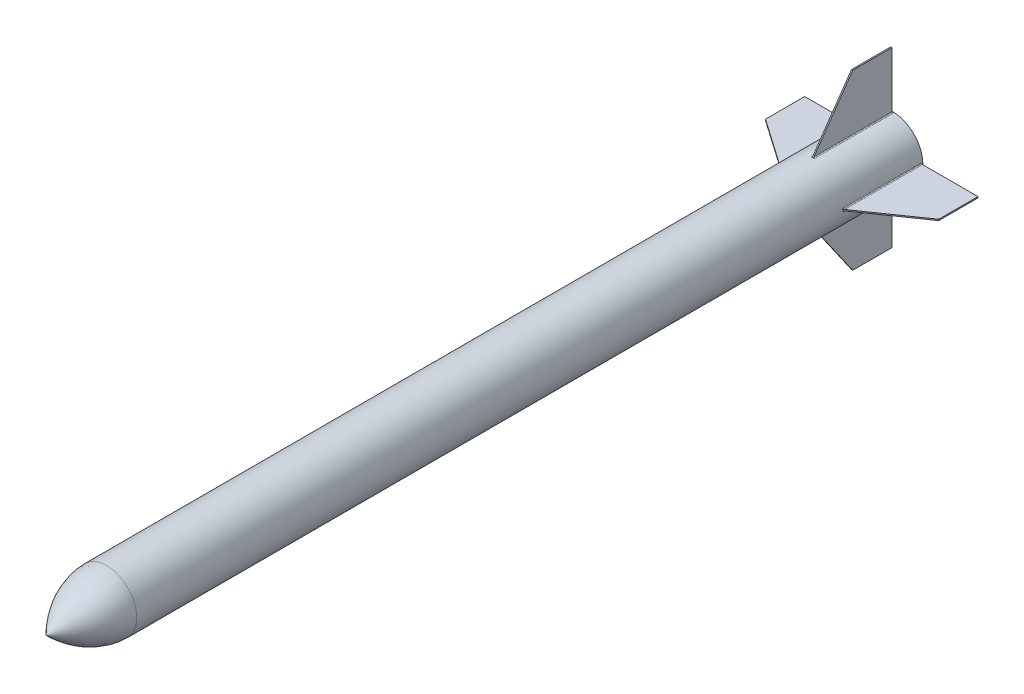
from build123d import *

# Parameters (mm, degrees)
SKETCH3_R                = 43.942
BOSS_EXTRUDE1_DEPTH      = 15.24
BOSS_EXTRUDE2_REACH      = 2240.211
BOSS_EXTRUDE2_END_RADIUS = 78.322932
SKETCH4_W                = 3.175
SKETCH4_H                = 203.2
CUT_EXTRUDE1_REACH       = 2229.902
FILLET1_R                = 2.54
CIRPATTERN1_COUNT        = 4
FILLET1_OF_CIRPATTERN1_R = 2.54


with BuildPart() as part:
    # Sketch2 → Revolve1 (revolve)
    with BuildSketch(Plane(origin=(0, 0, 0), x_dir=(0, 0, -1), z_dir=(1, 0, 0))):
        with BuildLine():
            Line((161.200401562, 77.77155292), (2196.692901562, 77.77155292))
            Line((2196.692901562, 77.77155292), (2196.692901562, -0.55137908))
            Line((2196.692901562, -0.55137908), (4.482401562, -0.55137908))
            add(Edge.make_bspline(
                [(4.482401562, -0.55137908), (82.841401562, 77.77155292), (161.200401562, 77.77155292)],
                knots=[0.067653722, 0.067653722, 0.067653722, 0.915241247, 0.915241247, 0.915241247], degree=2))
        make_face()
    revolve(axis=Axis((0, -0.55137908, -2196.692901562), (0, 0, 1)))

    # Sketch3 → Boss-Extrude1 (add)
    with BuildSketch(Plane(origin=(0, 0, -2196.692901562), x_dir=(-1, 0, 0), z_dir=(0, 0, -1))):
        with Locations(Location((0, 0, 0), (0, 0, 270))):
            Circle(SKETCH3_R)
    extrude(amount=BOSS_EXTRUDE1_DEPTH)

    # Boss-Extrude2: up to this cylinder (the profile starts outside it)
    boss_extrude2_end = Plane(origin=(0, -0.55137908, -2091.917902), z_dir=(0, 0, -1)) * Cylinder(BOSS_EXTRUDE2_END_RADIUS, 4638.067864, mode=Mode.PRIVATE)
    # Sketch4 → Boss-Extrude2 (add, up to the surface)
    with BuildSketch(Plane(origin=(0, 254, 0), x_dir=(1, 0, 0), z_dir=(0, 1, 0)), mode=Mode.PRIVATE) as boss_extrude2_sk1:
        with Locations((0, 2091.917901562)):
            Rectangle(SKETCH4_W, SKETCH4_H)
    boss_extrude2_tool1 = extrude(boss_extrude2_sk1.sketch, amount=-BOSS_EXTRUDE2_REACH, mode=Mode.PRIVATE) - boss_extrude2_end
    boss_extrude2 = boss_extrude2_tool1.solids().sort_by_distance((0, 254, -2091.917902))[0]
    add(boss_extrude2)

    # Sketch5 → Cut-Extrude1 (cut, up to next)
    with BuildSketch(Plane.ZY.offset(1.5875), mode=Mode.PRIVATE) as cut_extrude1_sk1:
        Polygon((-2193.517901562, 223.805463028), (-2091.917901562, 223.805463028), (-1990.317901562, 77.755463028), (-1990.317901562, 254), (-2193.517901562, 254), align=None)
    cut_extrude1_tool1 = extrude(cut_extrude1_sk1.sketch, amount=-CUT_EXTRUDE1_REACH, mode=Mode.PRIVATE) & part.part
    cut_extrude1 = cut_extrude1_tool1.solids().sort_by_distance((-1.5875, 203.992033, -2054.843652))[0]
    add(cut_extrude1, mode=Mode.SUBTRACT)

    # Fillet1
    # the kernel refuses this fillet: 2.54 mm, written as the material it adds along each edge
    with BuildSketch(Plane(origin=(-1.5875, 77.755463028, -1984.191199419), x_dir=(-0.9993639751499004, -0.035660134220012574, 0), z_dir=(0, 0, -1))) as fillet1_piece_1_section:
        with BuildLine():
            CenterArc((2.450992889, 2.539698904), FILLET1_R, 182.043608468, 87.074170625)
            Line((-0.087391608, 2.449122163), (0, 0))
            ThreePointArc((0, 0), (1.205942189, 0.009284527), (2.411884379, 0))
        make_face()
    fillet1_piece_1 = extrude(amount=209.326702143, mode=Mode.PRIVATE)
    fillet1_piece_1 = split(fillet1_piece_1, bisect_by=Plane(origin=(-3.095055571, 77.697259455, -1990.27741212), z_dir=(0, -0.5710644881986003, -0.820905201785487)), keep=Keep.TOP, mode=Mode.PRIVATE)
    add(fillet1_piece_1)
    with BuildSketch(Plane(origin=(1.5875, 77.755463028, -1984.191199419), x_dir=(0.9993639751499004, -0.03566013422001344, 0), z_dir=(0, 0, -1))) as fillet1_piece_2_section:
        with BuildLine():
            CenterArc((2.450992889, -2.539698904), FILLET1_R, 90.882220907, 87.074170625)
            Line((-0.087391608, -2.449122163), (0, 0))
            ThreePointArc((0, 0), (1.205942189, -0.009284527), (2.411884379, 0))
        make_face()
    fillet1_piece_2 = extrude(amount=209.326702143, mode=Mode.PRIVATE)
    fillet1_piece_2 = split(fillet1_piece_2, bisect_by=Plane(origin=(3.095055571, 77.697259455, -1990.27741212), z_dir=(0, -0.5710644881986003, -0.820905201785487)), keep=Keep.TOP, mode=Mode.PRIVATE)
    add(fillet1_piece_2)

    # CirPattern1: Boss-Extrude2, Cut-Extrude1 ×4 about axis
    cirpattern1_axis = Axis((0, -0.55137908, 0), (0, 0, 1))
    add([boss_extrude2.rotate(cirpattern1_axis, i * 360 / CIRPATTERN1_COUNT) for i in range(1, CIRPATTERN1_COUNT)])
    add([cut_extrude1.rotate(cirpattern1_axis, i * 360 / CIRPATTERN1_COUNT) for i in range(1, CIRPATTERN1_COUNT)], mode=Mode.SUBTRACT)

    # Fillet1 of CirPattern1
    # the kernel refuses this fillet: 2.54 mm, written as the material it adds along each edge
    with BuildSketch(Plane(origin=(-78.306842107, -2.13887908, -1984.191199419), x_dir=(0.035660134220018555, -0.9993639751499002, 0), z_dir=(0, 0, -1))) as fillet1_of_cirpattern1_piece_1_section:
        with BuildLine():
            CenterArc((2.450992889, 2.539698904), FILLET1_OF_CIRPATTERN1_R, 182.043608468, 87.074170625)
            Line((-0.087391608, 2.449122163), (0, 0))
            ThreePointArc((0, 0), (1.205942189, 0.009284527), (2.411884379, 0))
        make_face()
    fillet1_of_cirpattern1_piece_1 = extrude(amount=209.326702143, mode=Mode.PRIVATE)
    fillet1_of_cirpattern1_piece_1 = split(fillet1_of_cirpattern1_piece_1, bisect_by=Plane(origin=(-78.248638535, -3.646434651, -1990.27741212), z_dir=(0.5710644881986003, 0, -0.820905201785487)), keep=Keep.TOP, mode=Mode.PRIVATE)
    add(fillet1_of_cirpattern1_piece_1)
    with BuildSketch(Plane(origin=(-78.306842107, 1.03612092, -1984.191199419), x_dir=(0.03566013422001241, 0.9993639751499004, 0), z_dir=(0, 0, -1))) as fillet1_of_cirpattern1_piece_2_section:
        with BuildLine():
            CenterArc((2.450992889, -2.539698904), FILLET1_OF_CIRPATTERN1_R, 90.882220907, 87.074170625)
            Line((-0.087391608, -2.449122163), (0, 0))
            ThreePointArc((0, 0), (1.205942189, -0.009284527), (2.411884379, 0))
        make_face()
    fillet1_of_cirpattern1_piece_2 = extrude(amount=209.326702143, mode=Mode.PRIVATE)
    fillet1_of_cirpattern1_piece_2 = split(fillet1_of_cirpattern1_piece_2, bisect_by=Plane(origin=(-78.248638535, 2.543676491, -1990.27741212), z_dir=(0.5710644881986003, 0, -0.820905201785487)), keep=Keep.TOP, mode=Mode.PRIVATE)
    add(fillet1_of_cirpattern1_piece_2)
    with BuildSketch(Plane(origin=(1.5875, -78.858221187, -1984.191199419), x_dir=(0.9993639751499, 0.035660134220024196, 0), z_dir=(0, 0, -1))) as fillet1_of_cirpattern1_piece_3_section:
        with BuildLine():
            CenterArc((2.450992889, 2.539698904), FILLET1_OF_CIRPATTERN1_R, 182.043608468, 87.074170625)
            Line((-0.087391608, 2.449122163), (0, 0))
            ThreePointArc((0, 0), (1.205942189, 0.009284527), (2.411884379, 0))
        make_face()
    fillet1_of_cirpattern1_piece_3 = extrude(amount=209.326702143, mode=Mode.PRIVATE)
    fillet1_of_cirpattern1_piece_3 = split(fillet1_of_cirpattern1_piece_3, bisect_by=Plane(origin=(3.095055571, -78.800017614, -1990.27741212), z_dir=(0, 0.5710644881986003, -0.820905201785487)), keep=Keep.TOP, mode=Mode.PRIVATE)
    add(fillet1_of_cirpattern1_piece_3)
    with BuildSketch(Plane(origin=(-1.5875, -78.858221187, -1984.191199419), x_dir=(-0.9993639751499004, 0.03566013422001241, 0), z_dir=(0, 0, -1))) as fillet1_of_cirpattern1_piece_4_section:
        with BuildLine():
            CenterArc((2.450992889, -2.539698904), FILLET1_OF_CIRPATTERN1_R, 90.882220907, 87.074170625)
            Line((-0.087391608, -2.449122163), (0, 0))
            ThreePointArc((0, 0), (1.205942189, -0.009284527), (2.411884379, 0))
        make_face()
    fillet1_of_cirpattern1_piece_4 = extrude(amount=209.326702143, mode=Mode.PRIVATE)
    fillet1_of_cirpattern1_piece_4 = split(fillet1_of_cirpattern1_piece_4, bisect_by=Plane(origin=(-3.095055571, -78.800017614, -1990.27741212), z_dir=(0, 0.5710644881986003, -0.820905201785487)), keep=Keep.TOP, mode=Mode.PRIVATE)
    add(fillet1_of_cirpattern1_piece_4)
    with BuildSketch(Plane(origin=(78.306842107, 1.03612092, -1984.191199419), x_dir=(-0.03566013422001241, 0.9993639751499004, 0), z_dir=(0, 0, -1))) as fillet1_of_cirpattern1_piece_5_section:
        with BuildLine():
            CenterArc((2.450992889, 2.539698904), FILLET1_OF_CIRPATTERN1_R, 182.043608468, 87.074170625)
            Line((-0.087391608, 2.449122163), (0, 0))
            ThreePointArc((0, 0), (1.205942189, 0.009284527), (2.411884379, 0))
        make_face()
    fillet1_of_cirpattern1_piece_5 = extrude(amount=209.326702143, mode=Mode.PRIVATE)
    fillet1_of_cirpattern1_piece_5 = split(fillet1_of_cirpattern1_piece_5, bisect_by=Plane(origin=(78.248638535, 2.543676491, -1990.27741212), z_dir=(-0.5710644881986003, 0, -0.820905201785487)), keep=Keep.TOP, mode=Mode.PRIVATE)
    add(fillet1_of_cirpattern1_piece_5)
    with BuildSketch(Plane(origin=(78.306842107, -2.13887908, -1984.191199419), x_dir=(-0.03566013422001242, -0.9993639751499004, 0), z_dir=(0, 0, -1))) as fillet1_of_cirpattern1_piece_6_section:
        with BuildLine():
            CenterArc((2.450992889, -2.539698904), FILLET1_OF_CIRPATTERN1_R, 90.882220907, 87.074170625)
            Line((-0.087391608, -2.449122163), (0, 0))
            ThreePointArc((0, 0), (1.205942189, -0.009284527), (2.411884379, 0))
        make_face()
    fillet1_of_cirpattern1_piece_6 = extrude(amount=209.326702143, mode=Mode.PRIVATE)
    fillet1_of_cirpattern1_piece_6 = split(fillet1_of_cirpattern1_piece_6, bisect_by=Plane(origin=(78.248638535, -3.646434651, -1990.27741212), z_dir=(-0.5710644881986003, 0, -0.820905201785487)), keep=Keep.TOP, mode=Mode.PRIVATE)
    add(fillet1_of_cirpattern1_piece_6)


solid = part.part
